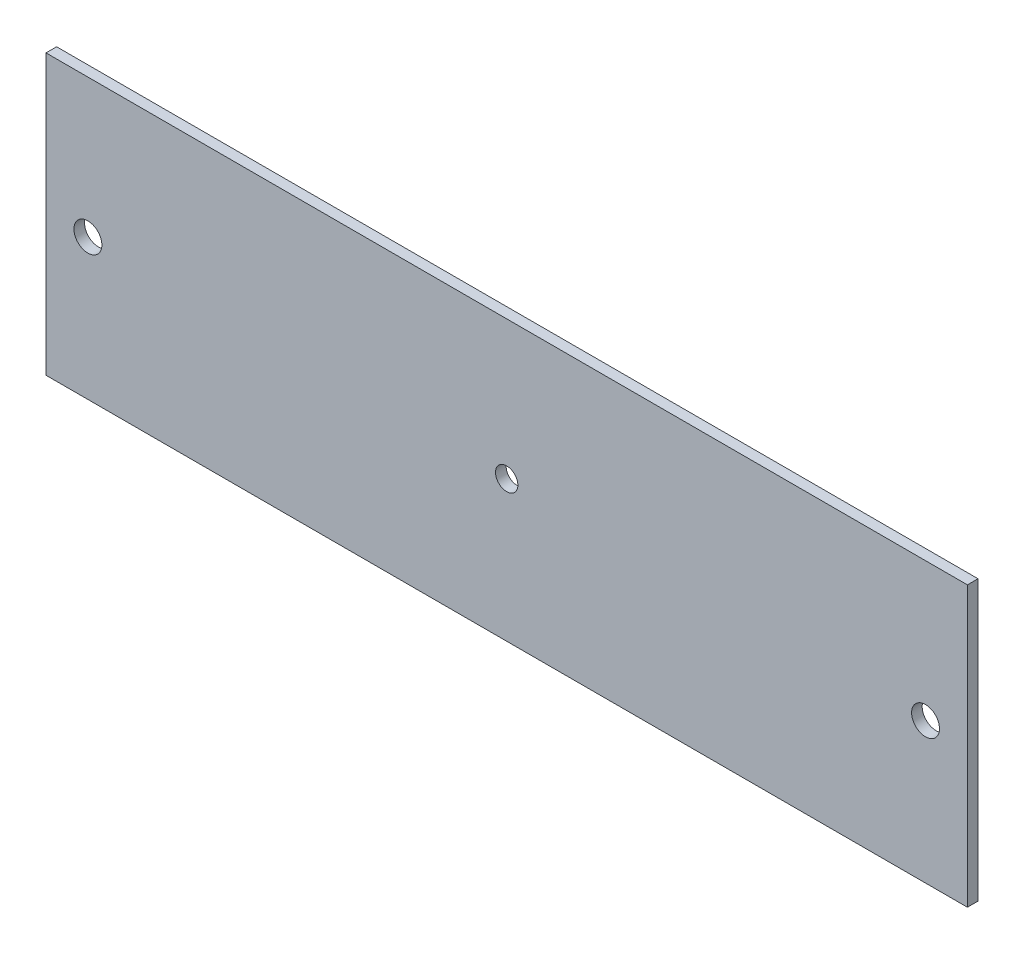
from build123d import *

# Parameters (mm, degrees)
SKETCH2_W          = 165
SKETCH2_H          = 50
BASE_FLANGE1_DEPTH = 1.89738
SKETCH7_R          = 2.5
SKETCH7_R_2        = 2
CUT_EXTRUDE1_DEPTH = 2


# Sheet-metal steps are written as plain solids
with BuildPart() as part:
    # Sketch2 → Base-Flange1 (new body)
    with BuildSketch(Plane.XY):
        with Locations((47.093573199, 9.376833926)):
            Rectangle(SKETCH2_W, SKETCH2_H)
    extrude(amount=-BASE_FLANGE1_DEPTH)

    # Sketch7 → Cut-Extrude1 (cut)
    with BuildSketch(Plane(origin=(0, 0, -1.89738), x_dir=(-1, 0, 0), z_dir=(0, 0, -1))):
        with Locations((-122.095775959, 9.558593498)):
            Circle(SKETCH7_R)
        with Locations((27.906426801, 9.571462067)):
            Circle(SKETCH7_R)
        with Locations((-47.093573199, 9.571462067)):
            Circle(SKETCH7_R_2)
    extrude(amount=-CUT_EXTRUDE1_DEPTH, mode=Mode.SUBTRACT)


solid = part.part
